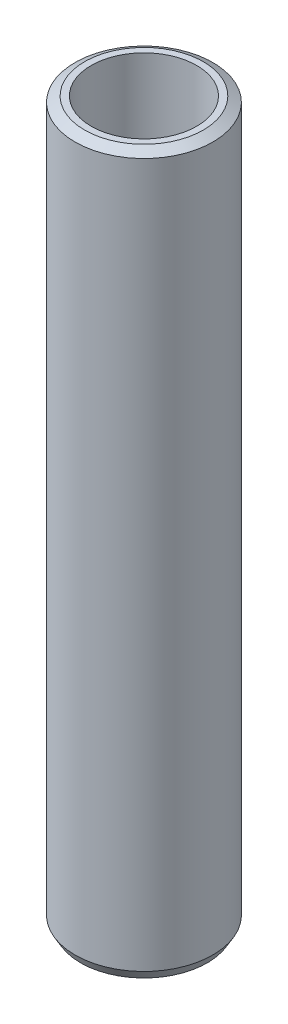
from build123d import *
from OCP.BRepFilletAPI import BRepFilletAPI_MakeChamfer

# Parameters (mm, degrees)
SKETCH1_R           = 57.5
BOSS_EXTRUDE1_DEPTH = 600
SKETCH2_R           = 44.003327467
CUT_EXTRUDE1_DEPTH  = 606.485342515
CHAMFER1_SIZE       = 4.626032224
CHAMFER1_SIZE2      = 8.01252285


with BuildPart() as part:
    # Sketch1 → Boss-Extrude1 (new body)
    with BuildSketch(Plane(origin=(0, 0, 0), x_dir=(1, 0, 0), z_dir=(0, 1, 0))):
        Circle(SKETCH1_R)
    extrude(amount=BOSS_EXTRUDE1_DEPTH)

    # Sketch2 → Cut-Extrude1 (cut, through all)
    with BuildSketch(Plane(origin=(0, 0, 0), x_dir=(1, 0, 0), z_dir=(0, 1, 0))):
        Circle(SKETCH2_R)
    extrude(amount=CUT_EXTRUDE1_DEPTH, mode=Mode.SUBTRACT)

    # Chamfer1: one chamfer whose edges measure the first distance from different faces: ONE call of the kernel's chamfer builder (chamfer() names one face for all edges)
    chamfer1_edges_1 = [part.edges().sort_by_distance(p)[0] for p in [
        (-57.5, 600, 0),
    ]]
    chamfer1_side_1 = [part.faces().sort_by_distance(p)[0] for p in [
        (-57.5, 300, 0),
    ]]
    chamfer1_edges_2 = [part.edges().sort_by_distance(p)[0] for p in [
        (-57.5, 0, 0),
    ]]
    chamfer1_side_2 = [part.faces().sort_by_distance(p)[0] for p in [
        (-55.873654403, 0, 0),
    ]]
    chamfer1 = BRepFilletAPI_MakeChamfer(part.part.solid().wrapped)
    for e in chamfer1_edges_1:
        chamfer1.Add(CHAMFER1_SIZE, CHAMFER1_SIZE2, e.wrapped, chamfer1_side_1[0].wrapped)  # the first distance lies on this face
    for e in chamfer1_edges_2:
        chamfer1.Add(CHAMFER1_SIZE, CHAMFER1_SIZE2, e.wrapped, chamfer1_side_2[0].wrapped)  # the first distance lies on this face
    add(Compound.cast(chamfer1.Shape()), mode=Mode.REPLACE)


solid = part.part
